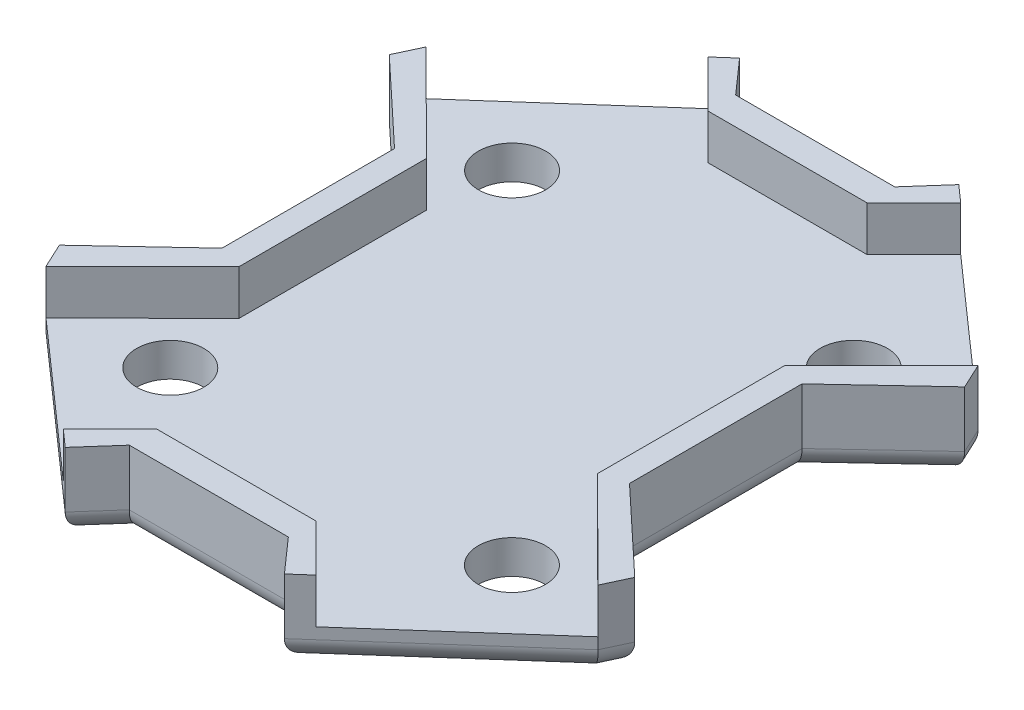
from build123d import *

# Parameters (mm, degrees)
SKETCH1_W           = 55
SKETCH1_H           = 64.43
BOSS_EXTRUDE1_DEPTH = 3
CUT_EXTRUDE1_DEPTH  = 4
SKETCH3_OUTSIDE_W   = 73.954
SKETCH3_OUTSIDE_H   = 83.384
CUT_EXTRUDE4_DEPTH  = 4
BOSS_EXTRUDE2_DEPTH = 3
BOSS_EXTRUDE3_DEPTH = 3
BOSS_EXTRUDE4_DEPTH = 4
BOSS_EXTRUDE5_DEPTH = 4
FILLET1_R           = 2
SKETCH9_R           = 1.75
CUT_EXTRUDE6_DEPTH  = 40.766745199
SKETCH10_R          = 3
CUT_EXTRUDE7_DEPTH  = 3


with BuildPart() as part:
    # Sketch1 → Boss-Extrude1 (new body)
    with BuildSketch(Plane(origin=(0, 0, 0), x_dir=(1, 0, 0), z_dir=(0, 1, 0))):
        Rectangle(SKETCH1_W, SKETCH1_H)
    extrude(amount=BOSS_EXTRUDE1_DEPTH)

    # Sketch2 → Cut-Extrude1 (cut)
    with BuildSketch(Plane(origin=(0, 3, 0), x_dir=(1, 0, 0), z_dir=(0, 1, 0))):
        Polygon((-27.5, -4.791277462), (-27.5, -14.373832386), (-17.5, -5), (-17.5, 5), (-27.5, 14.373832386), (-27.5, 4.791277462), align=None)
        Polygon((27.5, 4.791277462), (27.5, 14.373832386), (17.5, 5), (17.5, -5), (27.5, -14.373832386), (27.5, -4.791277462), align=None)
    extrude(amount=-CUT_EXTRUDE1_DEPTH, mode=Mode.SUBTRACT)

    # Sketch3 outside → Cut-Extrude4 (cut)
    with BuildSketch(Plane(origin=(0, 3, 0), x_dir=(1, 0, 0), z_dir=(0, 1, 0))):
        Rectangle(SKETCH3_OUTSIDE_W, SKETCH3_OUTSIDE_H)
        Polygon((-16, -5.649903378), (-16, 0), (-16, 5.649903378), (-25.681219861, 14.724916605), (-24.640371834, 16.957022404), (-9.782767538, 30.09765722), (-4.418267546, 24.032225889), (4.418267546, 24.032225889), (9.782767538, 30.09765722), (24.640371834, 16.957022404), (25.681219861, 14.724916605), (16, 5.649903378), (16, -5.649903378), (25.681219861, -14.724916605), (24.640371834, -16.957022404), (9.782767538, -30.09765722), (4.418267546, -24.032225889), (-4.418267546, -24.032225889), (-9.782767538, -30.09765722), (-24.640371834, -16.957022404), (-25.681219861, -14.724916605), align=None, mode=Mode.SUBTRACT)
    extrude(amount=-CUT_EXTRUDE4_DEPTH, mode=Mode.SUBTRACT)

    # Sketch4 → Boss-Extrude2 (add)
    with BuildSketch(Plane(origin=(0, 3, 0), x_dir=(1, 0, 0), z_dir=(0, 1, 0))):
        Polygon((-7.100517542, 27.064941555), (7.100517542, 27.064941555), (4.418267546, 24.032225889), (-4.418267546, 24.032225889), align=None)
        Polygon((-7.100517542, -27.064941555), (7.100517542, -27.064941555), (4.418267546, -24.032225889), (-4.418267546, -24.032225889), align=None)
    extrude(amount=-BOSS_EXTRUDE2_DEPTH)

    # Sketch5 → Boss-Extrude3 (add)
    with BuildSketch(Plane(origin=(0, 3, 0), x_dir=(1, 0, 0), z_dir=(0, 1, 0))):
        Polygon((-16, 5.649903378), (-18.188739123, 7.701590745), (-18.188739123, -7.701590745), (-16, -5.649903378), align=None)
        Polygon((16, 5.649903378), (18.188739123, 7.701590745), (18.188739123, -7.701590745), (16, -5.649903378), align=None)
    extrude(amount=-BOSS_EXTRUDE3_DEPTH)

    # Sketch6 → Boss-Extrude4 (add)
    with BuildSketch(Plane(origin=(0, 3, 0), x_dir=(1, 0, 0), z_dir=(0, 1, 0))):
        Polygon((-24.640371834, -16.957022404), (-25.681219861, -14.724916605), (-18.188739123, -7.701590745), (-18.188739123, 7.701590745), (-25.681219861, 14.724916605), (-24.640371834, 16.957022404), (-16, 8.373408054), (-16, -8.373408054), align=None)
        Polygon((16, -8.373408054), (24.640371834, -16.957022404), (25.681219861, -14.724916605), (18.188739123, -7.701590745), (18.188739123, 7.701590745), (25.681219861, 14.724916605), (24.640371834, 16.957022404), (16, 8.373408054), align=None)
    extrude(amount=BOSS_EXTRUDE4_DEPTH)

    # Sketch7 → Boss-Extrude5 (add)
    with BuildSketch(Plane(origin=(0, 3, 0), x_dir=(1, 0, 0), z_dir=(0, 1, 0))):
        Polygon((-1, 27.064941555), (-7.100517542, 27.064941555), (-9.782767538, 30.09765722), (-11.280892286, 28.772658262), (-7.100517542, 24.594941555), (-1, 24.594941555), (1, 24.594941555), (7.100517542, 24.594941555), (11.280892286, 28.772658262), (9.782767538, 30.09765722), (7.100517542, 27.064941555), (1, 27.064941555), align=None)
        Polygon((-1, -27.064941555), (-7.100517542, -27.064941555), (-9.782767538, -30.09765722), (-11.280892286, -28.772658262), (-7.100517542, -24.594941555), (-1, -24.594941555), (1, -24.594941555), (7.100517542, -24.594941555), (11.280892286, -28.772658262), (9.782767538, -30.09765722), (7.100517542, -27.064941555), (1, -27.064941555), align=None)
    extrude(amount=BOSS_EXTRUDE5_DEPTH)

    # Fillet1
    fillet1_edges = [part.edges().sort_by_distance(p)[0] for p in [
        (25.160795848, 0, -15.840969504),
        (21.934979492, 0, -11.213253675),
        (18.188739123, 0, 0),
        (21.934979492, 0, 11.213253675),
        (25.160795848, 0, 15.840969504),
        (17.211569686, 0, 23.527339812),
        (8.44164254, 0, 28.581299387),
        (0, 0, 27.064941555),
        (-8.44164254, 0, 28.581299387),
        (-17.211569686, 0, 23.527339812),
        (-25.160795848, 0, 15.840969504),
        (-21.934979492, 0, 11.213253675),
        (-18.188739123, 0, 0),
        (-25.160795848, 0, -15.840969504),
        (-21.934979492, 0, -11.213253675),
        (-17.211569686, 0, -23.527339812),
        (-8.44164254, 0, -28.581299387),
        (0, 0, -27.064941555),
        (8.44164254, 0, -28.581299387),
        (17.211569686, 0, -23.527339812),
    ]]
    fillet(fillet1_edges, radius=FILLET1_R)

    # Sketch9 → Cut-Extrude6 (cut, through all)
    with BuildSketch(Plane(origin=(0, 3, 0), x_dir=(1, 0, 0), z_dir=(0, 1, 0))):
        with Locations((15.251219861, -15.244152763)):
            Circle(SKETCH9_R)
        with Locations((15.251219861, 15.255847237)):
            Circle(SKETCH9_R)
        with Locations((-15.248780139, 15.255847237)):
            Circle(SKETCH9_R)
        with Locations((-15.248780139, -15.244152763)):
            Circle(SKETCH9_R)
    extrude(amount=-CUT_EXTRUDE6_DEPTH, mode=Mode.SUBTRACT)

    # Sketch10 → Cut-Extrude7 (cut)
    with BuildSketch(Plane.XZ):
        with Locations((-15.248780139, -15.255847237)):
            Circle(SKETCH10_R)
        with Locations((-15.248780139, 15.255847237)):
            Circle(SKETCH10_R)
        with Locations((15.248780139, -15.255847237)):
            Circle(SKETCH10_R)
        with Locations((15.248780139, 15.255847237)):
            Circle(SKETCH10_R)
    extrude(amount=-CUT_EXTRUDE7_DEPTH, mode=Mode.SUBTRACT)


solid = part.part
